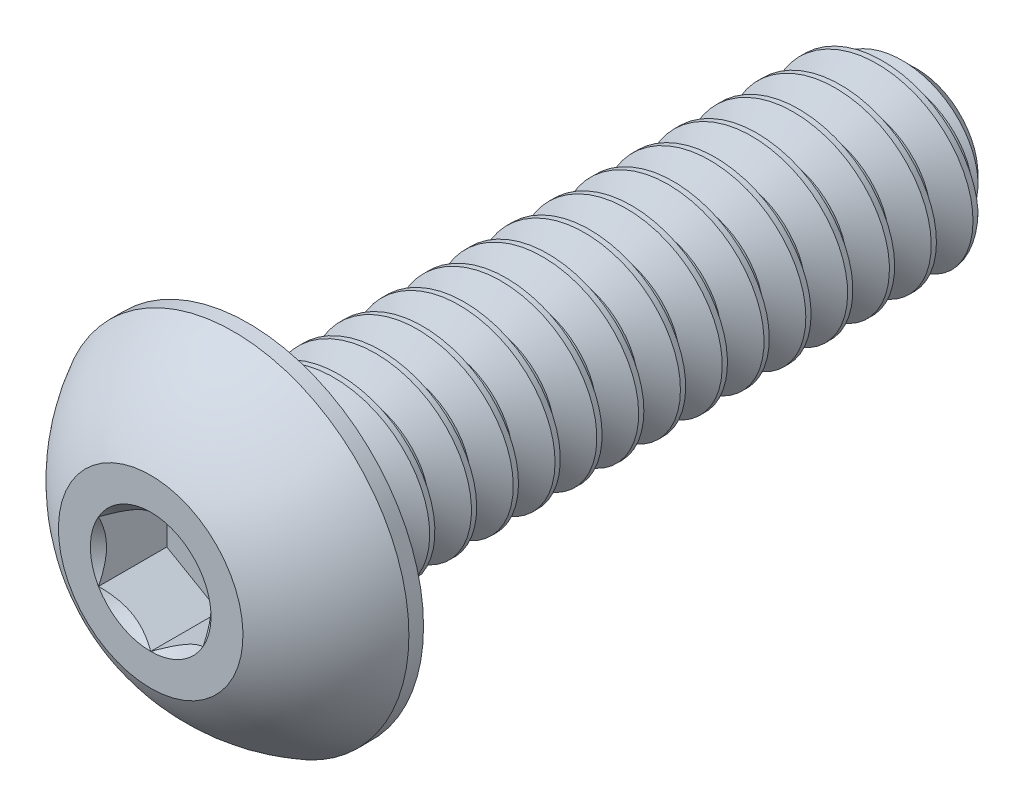
from build123d import *

# Parameters (mm, degrees)
SKETCH1_W          = 12.7
SKETCH1_H          = 1.7526
CHAMFER1_SIZE      = 0.5953125
CUT_SWEEP1_PITCH   = 0.79375
CUT_EXTRUDE2_DEPTH = 1.29794


with BuildPart() as part:
    # Sketch1 → Revolve1 (revolve)
    with BuildSketch(Plane(origin=(0, 0, 0), x_dir=(0, 0, -1), z_dir=(1, 0, 0))):
        with Locations((8.2042, 0.8763)):
            Rectangle(SKETCH1_W, SKETCH1_H)
    revolve(axis=Axis((0, 0, -14.5542), (0, 0, 1)))

    # Chamfer1
    chamfer1_edges = [part.edges().sort_by_distance(p)[0] for p in [
        (0, -1.7526, -14.5542),
    ]]
    chamfer(chamfer1_edges, length=CHAMFER1_SIZE)

    # Cut-Sweep1: arcs per turn and ends read off the stored shape
    # Cut-Sweep1: the profile of Sketch2 profile screwed along a right-hand helix through 17 turns, 8 arcs to a turn; built about Z, then put on its axis
    cut_sweep1_z = Axis((0, 0, 0), (0, 0, 1))
    cut_sweep1_corners = [(1.7529, 0, 0.000173205), (1.7529, 0, -0.694704455), (1.237044252, 0, -0.396875), (1.237044252, 0, -0.29765625)]
    with BuildLine(mode=Mode.PRIVATE) as cut_sweep1_profile:
        Line(cut_sweep1_corners[0], cut_sweep1_corners[1])
        Line(cut_sweep1_corners[1], cut_sweep1_corners[2])
        Line(cut_sweep1_corners[2], cut_sweep1_corners[3])
        Line(cut_sweep1_corners[3], cut_sweep1_corners[0])
    cut_sweep1_cap = Face(cut_sweep1_profile.wire())
    cut_sweep1_turn_angles = [0, 22.5, 45, 67.5, 90, 112.5, 135, 157.5, 180, 202.5, 225, 247.5, 270, 292.5, 315, 337.5, 360]
    cut_sweep1_turn_weights = [1, 0.9238795325112867, 1, 0.9238795325112867, 1, 0.9238795325112867, 1, 0.9238795325112867, 1, 0.9238795325112867, 1, 0.9238795325112867, 1, 0.9238795325112867, 1, 0.9238795325112867, 1]
    cut_sweep1_turn_rails = [Edge.make_bspline([Vector(p[0], p[1], 0).rotate(cut_sweep1_z, cut_sweep1_turn_angles[k]) / cut_sweep1_turn_weights[k] + Vector(0, 0, p[2] + CUT_SWEEP1_PITCH * cut_sweep1_turn_angles[k] / 360) for k in range(17)], [0, 0, 0, 1, 1, 2, 2, 3, 3, 4, 4, 5, 5, 6, 6, 7, 7, 8, 8, 8], 2, cut_sweep1_turn_weights) for p in cut_sweep1_corners]
    cut_sweep1_turn_sides = [Face.make_surface_from_curves(cut_sweep1_turn_rails[p[0]], cut_sweep1_turn_rails[p[1]]) for p in [(0, 1), (1, 2), (2, 3), (3, 0)]]
    cut_sweep1 = Plane(origin=(0, 0, -14.5542), x_dir=(0, 1, 0), z_dir=(0, 0, 1)) * Solid(Shell([*[p.moved(Location((0, 0, CUT_SWEEP1_PITCH * i))) for i in range(17) for p in cut_sweep1_turn_sides], cut_sweep1_cap, cut_sweep1_cap.rotate(cut_sweep1_z, 6120).moved(Location((0, 0, CUT_SWEEP1_PITCH * 6120 / 360)))]))
    add(cut_sweep1, mode=Mode.SUBTRACT)

    # Sketch7 → Revolve2 (revolve)
    with BuildSketch(Plane(origin=(0, 0, 0), x_dir=(0, 0, -1), z_dir=(1, 0, 0)), mode=Mode.PRIVATE) as revolve2_sk:
        with BuildLine():
            Line((1.57607, 3.3274), (1.8542, 3.3274))
            Line((1.8542, 3.3274), (1.8542, 0))
            Line((1.8542, 0), (0, 0))
            Line((0, 0), (0, 1.7526))
            ThreePointArc((0, 1.7526), (0.668695369, 2.659435873), (1.57607, 3.3274))
        make_face()
    revolve(revolve2_sk.sketch.rotate(Axis((0, 0, 0), (0, 0, -1)), 189.052465709), axis=Axis((0, 0, 0), (0, 0, -1)))

    # Sketch5 → Cut-Extrude2 (cut)
    with BuildSketch(Plane.XY):
        Polygon((0.9921875, -0.57283972), (0.9921875, 0.57283972), (0, 1.14567944), (-0.9921875, 0.57283972), (-0.9921875, -0.57283972), (0, -1.14567944), align=None)
    extrude(amount=-CUT_EXTRUDE2_DEPTH, mode=Mode.SUBTRACT)

    # Cut-Extrude3 cone 1 section (through the dimple's axis) → Cut-Extrude3 (revolve, cut)
    with BuildSketch(Plane(origin=(0, 0, 0), x_dir=(0, -1, 0), z_dir=(1, 0, 0))):
        Polygon((0, 0), (1.14567944, 0), (0, 1.14567944), align=None)
    revolve(axis=Axis((0, 0, 0), (0, 0, -1)), mode=Mode.SUBTRACT)


solid = part.part
